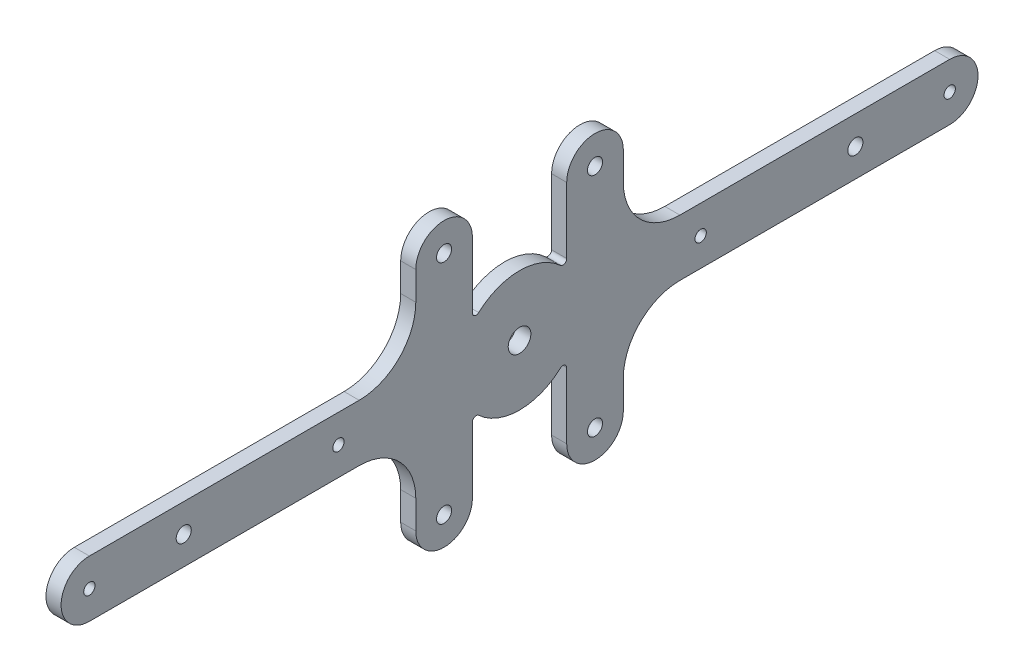
from build123d import *

# Parameters (mm, degrees)
SKETCH1_W            = 250
SKETCH1_H            = 90
BOSS_EXTRUDE1_DEPTH  = 4
SKETCH2_R            = 3
SKETCH2_R_2          = 1.5
SKETCH2_R_3          = 2
CUT_EXTRUDE1_DEPTH   = 133.91350571
SKETCH3_R            = 2
CUT_EXTRUDE2_DEPTH   = 133.91350571
CUT_EXTRUDE3_DEPTH   = 133.91350571
FILLET1_R            = 1
FILLET1_OF_MIRROR2_R = 1
MIRROR3_OUTLINE_R    = 1.5
MIRROR3_OUTLINE_R_2  = 2
MIRROR3_DEPTH        = 4


# Read off the part's stored shape, not the designer's step: Mirror3
with BuildPart() as part:
    # Sketch1 → Boss-Extrude1 (new body)
    with BuildSketch(Plane(origin=(0, 0, 0), x_dir=(0, 0, -1), z_dir=(1, 0, 0))):
        Rectangle(SKETCH1_W, SKETCH1_H)
    extrude(amount=BOSS_EXTRUDE1_DEPTH)

    # Sketch2 → Cut-Extrude1 (cut, through all)
    with BuildSketch(Plane(origin=(4, 0, 0), x_dir=(0, 0, -1), z_dir=(1, 0, 0))):
        Circle(SKETCH2_R)
        with Locations((-48, 0)):
            Circle(SKETCH2_R_2)
        with Locations((-89, 0)):
            Circle(SKETCH2_R_3)
        with Locations((-114, 0)):
            Circle(SKETCH2_R_2)
    extrude(amount=-CUT_EXTRUDE1_DEPTH, mode=Mode.SUBTRACT)

    # Sketch3 → Cut-Extrude2 (cut, through all)
    with BuildSketch(Plane(origin=(4, 0, 0), x_dir=(0, 0, -1), z_dir=(1, 0, 0))):
        with Locations((-20, 30)):
            Circle(SKETCH3_R)
    cut_extrude2 = extrude(amount=-CUT_EXTRUDE2_DEPTH, mode=Mode.SUBTRACT)

    # Sketch4 → Cut-Extrude3 (cut, through all)
    with BuildSketch(Plane(origin=(4, 0, 0), x_dir=(0, 0, -1), z_dir=(1, 0, 0))):
        with BuildLine():
            Line((-114, 7.5), (-50, 7.5))
            Line((-50, 7.5), (-42.5, 7.5))
            ThreePointArc((-42.5, 7.5), (-31.893398282, 11.893398282), (-27.5, 22.5))
            Line((-27.5, 22.5), (-27.5, 30))
            ThreePointArc((-27.5, 30), (-20, 37.5), (-12.5, 30))
            Line((-12.5, 30), (-12.5, 10))
            ThreePointArc((-12.5, 10), (-6.934403149, 14.427891494), (0, 16.007810594))
            Line((0, 16.007810594), (0, 45))
            Line((0, 45), (-125, 45))
            Line((-125, 45), (-125, 1.99556796))
            Line((-125, 1.99556796), (-125, 0))
            Line((-125, 0), (-121.5, 0))
            ThreePointArc((-121.5, 0), (-119.303300859, 5.303300859), (-114, 7.5))
        make_face()
    cut_extrude3 = extrude(amount=-CUT_EXTRUDE3_DEPTH, mode=Mode.SUBTRACT)

    # Fillet1
    fillet1_edges = [part.edges().sort_by_distance(p)[0] for p in [
        (2, 10, 12.5),
    ]]
    fillet(fillet1_edges, radius=FILLET1_R)

    # Mirror2: Cut-Extrude2, Cut-Extrude3 across plane
    add(cut_extrude2.mirror(Plane.ZX), mode=Mode.SUBTRACT)
    add(cut_extrude3.mirror(Plane.ZX), mode=Mode.SUBTRACT)

    # Fillet1 of Mirror2
    fillet1_of_mirror2_edges = [part.edges().sort_by_distance(p)[0] for p in [
        (2, -10, 12.5),
    ]]
    fillet(fillet1_of_mirror2_edges, radius=FILLET1_OF_MIRROR2_R)

    # Mirror3 outline → Mirror3 (cut)
    with BuildSketch(Plane.YZ):
        with BuildLine():
            Line((7.5, -42.5), (7.5, -114))
            ThreePointArc((7.5, -114), (0, -121.5), (-7.5, -114))
            Line((-7.5, -114), (-7.5, -42.5))
            ThreePointArc((-7.5, -42.5), (-11.893398282, -31.893398282), (-22.5, -27.5))
            Line((-22.5, -27.5), (-30, -27.5))
            ThreePointArc((-30, -27.5), (-37.5, -20), (-30, -12.5))
            Line((-30, -12.5), (-12.530587424, -12.5))
            ThreePointArc((-12.530587424, -12.5), (-11.615120349, -11.902392887), (-11.793832546, -10.823840071))
            ThreePointArc((-11.793832546, -10.823840071), (-14.917161888, -5.807605463), (-16.007810594, 0))
            Line((-16.007810594, 0), (-45, 0))
            Line((-45, 0), (-45, -125))
            Line((-45, -125), (45, -125))
            Line((45, -125), (45, 0))
            Line((45, 0), (16.007810594, 0))
            ThreePointArc((16.007810594, 0), (14.917161888, -5.807605463), (11.793832546, -10.823840071))
            ThreePointArc((11.793832546, -10.823840071), (11.615120349, -11.902392887), (12.530587424, -12.5))
            Line((12.530587424, -12.5), (30, -12.5))
            ThreePointArc((30, -12.5), (37.5, -20), (30, -27.5))
            Line((30, -27.5), (22.5, -27.5))
            ThreePointArc((22.5, -27.5), (11.893398282, -31.893398282), (7.5, -42.5))
        make_face()
        with Locations((0, -114)):
            Circle(MIRROR3_OUTLINE_R)
        with Locations((0, -89)):
            Circle(MIRROR3_OUTLINE_R_2)
        with Locations((0, -48)):
            Circle(MIRROR3_OUTLINE_R)
        with Locations((30, -20)):
            Circle(MIRROR3_OUTLINE_R_2)
        with Locations((-30, -20)):
            Circle(MIRROR3_OUTLINE_R_2)
    extrude(amount=MIRROR3_DEPTH, mode=Mode.SUBTRACT)


solid = part.part
